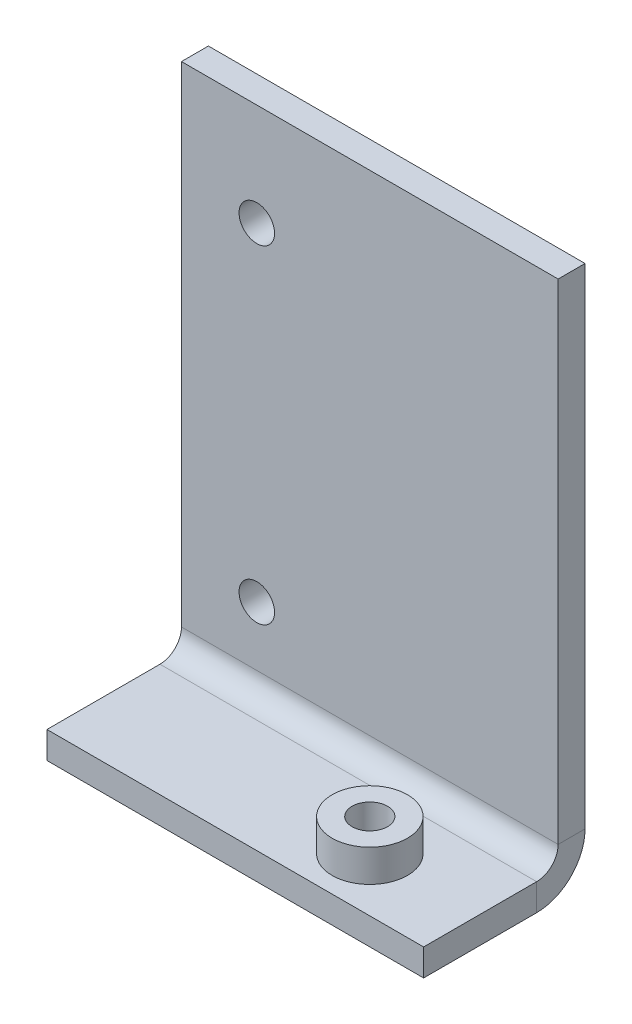
from build123d import *

# Parameters (mm, degrees)
SKETCH_1_W                       = 35
SKETCH_1_H                       = 50
EXTRUDE_1_DEPTH                  = 2.5
SKETCH_2_R                       = 1.65
CUT_EXTRUDE_1_DEPTH              = 10
SM_EDGE_FLANGE_2_STRIP_W         = 14
SM_EDGE_FLANGE_2_STRIP_H         = 2.5
SM_EDGE_FLANGE_2_STRIP_CUT_DEPTH = 35
SM_EDGE_FLANGE_2_DEPTH           = 35
SKETCH_19_R                      = 3.5
EXTRUDE_2_DEPTH                  = 3
SKETCH_20_R                      = 1.65
CUT_EXTRUDE_2_DEPTH              = 10


# Sheet-metal steps are written as plain solids
with BuildPart() as part:
    # 草图1 → 凸台-拉伸1 (new body)
    with BuildSketch(Plane.XY):
        with Locations((17.5, 25)):
            Rectangle(SKETCH_1_W, SKETCH_1_H)
    extrude(amount=EXTRUDE_1_DEPTH)

    # 草图2 → 切除-拉伸1 (cut)
    with BuildSketch(Plane.XY.offset(2.5)):
        with Locations((7, 40.5)):
            Circle(SKETCH_2_R)
        with Locations((7, 10)):
            Circle(SKETCH_2_R)
    extrude(amount=-CUT_EXTRUDE_1_DEPTH, mode=Mode.SUBTRACT)

    # 边线-法兰2 strip (across the edge) → 边线-法兰2 strip cut (cut)
    with BuildSketch(Plane(origin=(0, 0, 2.5), x_dir=(0, 1, 0), z_dir=(1, 0, 0))):
        with Locations((-2.5, -1.25)):
            Rectangle(SM_EDGE_FLANGE_2_STRIP_W, SM_EDGE_FLANGE_2_STRIP_H)
    extrude(amount=SM_EDGE_FLANGE_2_STRIP_CUT_DEPTH, mode=Mode.SUBTRACT)

    # 边线-法兰2 section (across the edge) → 边线-法兰2 (add)
    with BuildSketch(Plane(origin=(0, 0, 2.5), x_dir=(0, 1, 0), z_dir=(1, 0, 0))):
        with BuildLine():
            Line((0, 2), (0, 12.5))
            Line((0, 12.5), (2.5, 12.5))
            Line((2.5, 12.5), (2.5, 2))
            ThreePointArc((2.5, 2), (3.085786438, 0.585786438), (4.5, 0))
            Line((4.5, 0), (4.5, -2.5))
            ThreePointArc((4.5, -2.5), (1.318019485, -1.181980515), (0, 2))
        make_face()
    extrude(amount=SM_EDGE_FLANGE_2_DEPTH)

    # 草图19 → 凸台-拉伸2 (add)
    with BuildSketch(Plane(origin=(0, 2.5, 0), x_dir=(1, 0, 0), z_dir=(0, 1, 0))):
        with Locations(Location((25, -10, 0), (0, 0, 270))):
            Circle(SKETCH_19_R)
    extrude(amount=EXTRUDE_2_DEPTH)

    # 草图20 → 切除-拉伸2 (cut)
    with BuildSketch(Plane(origin=(0, 5.5, 0), x_dir=(1, 0, 0), z_dir=(0, 1, 0))):
        with Locations(Location((25, -10, 0), (0, 0, 270))):
            Circle(SKETCH_20_R)
    extrude(amount=-CUT_EXTRUDE_2_DEPTH, mode=Mode.SUBTRACT)


solid = part.part
